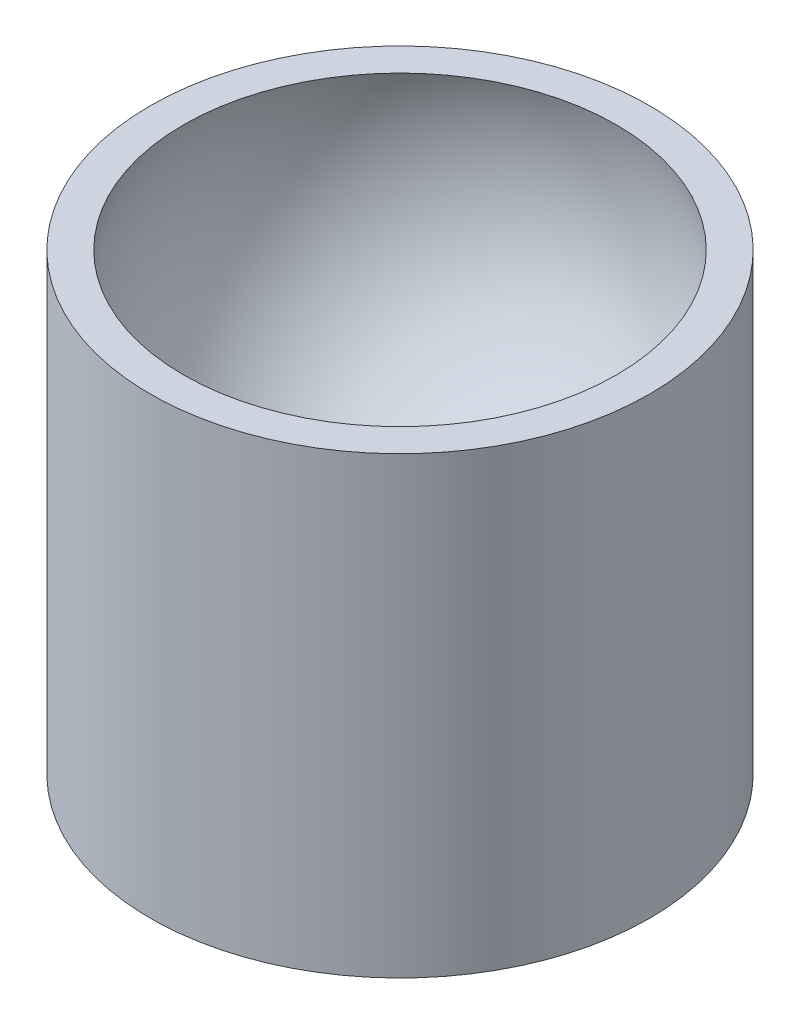
from build123d import *

# Parameters (mm, degrees)
SKETCH_3_R          = 5
CUT_EXTRUDE_1_DEPTH = 26.337718919


with BuildPart() as part:
    # 扫描1: sweep along a path in 草图2
    with BuildLine(Plane(origin=(0, 0, 0), x_dir=(1, 0, 0), z_dir=(0, 1, 0))) as sweep_1_path:
        CenterArc((0, 0), 11, 0, 360)
    # 草图1 → 扫描1 (sweep)
    with BuildSketch(Plane.XY):
        with BuildLine():
            Line((11, 3), (11, -17))
            Line((11, -17), (0, -17))
            Line((0, -17), (0, -10))
            ThreePointArc((0, -10), (8.062257748, -5.916079783), (9.539392014, 3))
            Line((9.539392014, 3), (11, 3))
        make_face()
    sweep(path=sweep_1_path.line)

    # 草图3 → 切除-拉伸1 (cut, through all)
    with BuildSketch(Plane.XZ.offset(17)):
        Circle(SKETCH_3_R)
    extrude(amount=-CUT_EXTRUDE_1_DEPTH, mode=Mode.SUBTRACT)


solid = part.part
